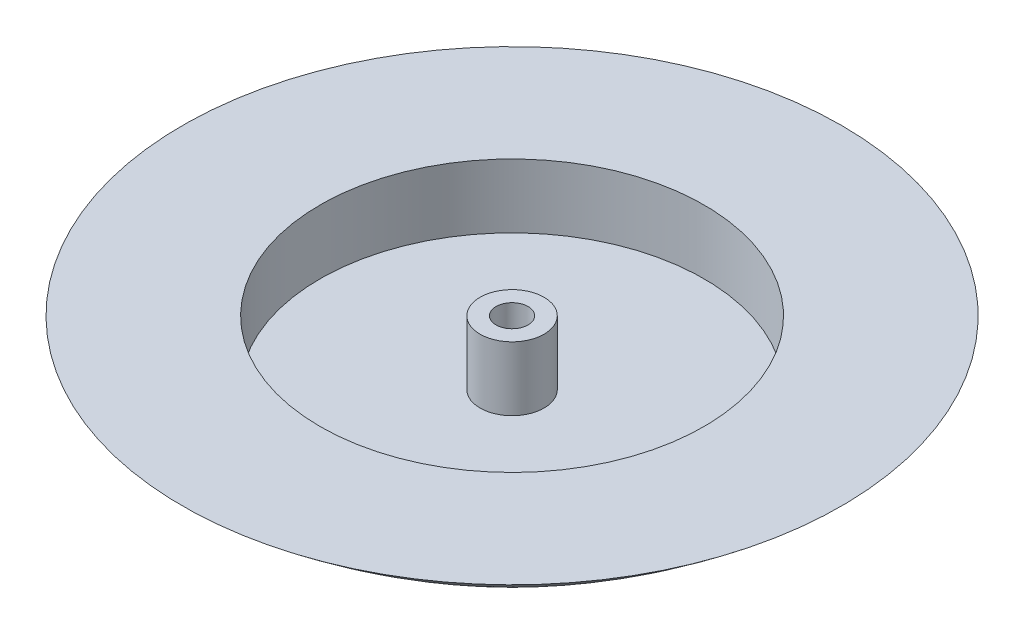
from build123d import *

# Parameters (mm, degrees)
SKETCH_3_R            = 30
SKETCH_3_R_2          = 5
CUT_EXTRUDE_2_DEPTH   = 10
HOLE_WIZARD_M61_D     = 5
HOLE_WIZARD_M61_DEPTH = 18.497848452
HOLE_WIZARD_M61_TIP   = 1.502151548


# Read off the part's stored shape, not the designer's step: Повернуть1
with BuildPart() as part:
    # Повернуть1 outline → Повернуть1 (revolve)
    with BuildSketch(Plane.XY):
        with BuildLine():
            Line((51.5, 26.48165559), (0, 26.48165559))
            Line((0, 26.48165559), (0, 0))
            add(Edge.make_bspline(
                [(0, 0), (0.156539895, 0.04133193), (0.469530076, 0.124531455), (1.095511669, 0.293183386), (1.873554951, 0.508331121), (2.649123351, 0.72837407), (3.423412252, 0.953638071), (4.013733879, 1.128266984), (4.844912611, 1.379694221), (5.317842465, 1.525671383), (6.509276852, 1.898728563), (7.243327053, 2.140034066), (8.307207562, 2.490567159), (9.181175291, 2.790749017), (10.392512094, 3.212408176), (11.533241177, 3.625618199), (12.713980503, 4.064307324), (13.864030789, 4.506730701), (14.793237788, 4.871354824), (15.943087068, 5.333377234), (17.321790678, 5.90311205), (18.91905871, 6.587105086), (20.734253685, 7.396581431), (22.536340181, 8.232758503), (24.326293905, 9.095556138), (26.103269747, 9.984556153), (27.867020214, 10.899103073), (29.617801935, 11.839314226), (31.60461842, 12.942813624), (33.574135616, 14.080801884), (35.521819214, 15.249061859), (37.454629603, 16.452505613), (39.122688535, 17.521509213), (41.203774914, 18.896658569), (43.236844805, 20.2890197), (45.285661909, 21.748137101), (47.248723401, 23.192176829), (48.69894305, 24.290874197), (49.764977395, 25.111263846), (50.815325911, 25.937355121), (51.180281148, 26.226459124), (51.421791087, 26.419144579), (51.5, 26.48165559)],
                knots=[0, 0, 0, 0, 0, 0.010253591, 0.020507182, 0.041014364, 0.051142143, 0.061269922, 0.071397702, 0.081525481, 0.097247494, 0.112969508, 0.128691521, 0.144413535, 0.160135548, 0.175857562, 0.207301586, 0.223023601, 0.238745616, 0.254467629, 0.270189641, 0.301633667, 0.333077698, 0.364521719, 0.395965752, 0.427409779, 0.458853799, 0.490297837, 0.521741856, 0.553185882, 0.60276153, 0.634205558, 0.665649585, 0.697093613, 0.728537641, 0.791425689, 0.822869716, 0.854313743, 0.885757777, 0.901479794, 0.91720181, 0.92423633, 0.92423633, 0.92423633, 0.92423633, 0.92423633], degree=4))
        make_face()
    revolve(axis=Axis((0, 0, 0), (0, 1, 0)))

    # Эскиз3 → Вырез-Вытянуть2 (cut)
    with BuildSketch(Plane(origin=(0, 26.48165559, 0), x_dir=(1, 0, 0), z_dir=(0, 1, 0))):
        with Locations(Location((0, 0, 0), (0, 0, 270))):
            Circle(SKETCH_3_R)
        with Locations(Location((0, 0, 0), (0, 0, 270))):
            Circle(SKETCH_3_R_2, mode=Mode.SUBTRACT)
    extrude(amount=-CUT_EXTRUDE_2_DEPTH, mode=Mode.SUBTRACT)

    # Отверстие обработанное метчиком M61
    with Locations(Plane(origin=(0, 26.48165559, 0), x_dir=(1, 0, 0), z_dir=(0, 1, 0))):
        with Locations((0, 0)):
            Hole(HOLE_WIZARD_M61_D / 2, depth=HOLE_WIZARD_M61_DEPTH)
            with Locations((0, 0, -(HOLE_WIZARD_M61_DEPTH + HOLE_WIZARD_M61_TIP / 2))):  # 118° drill point
                Cone(0, HOLE_WIZARD_M61_D / 2, HOLE_WIZARD_M61_TIP, mode=Mode.SUBTRACT)


solid = part.part
